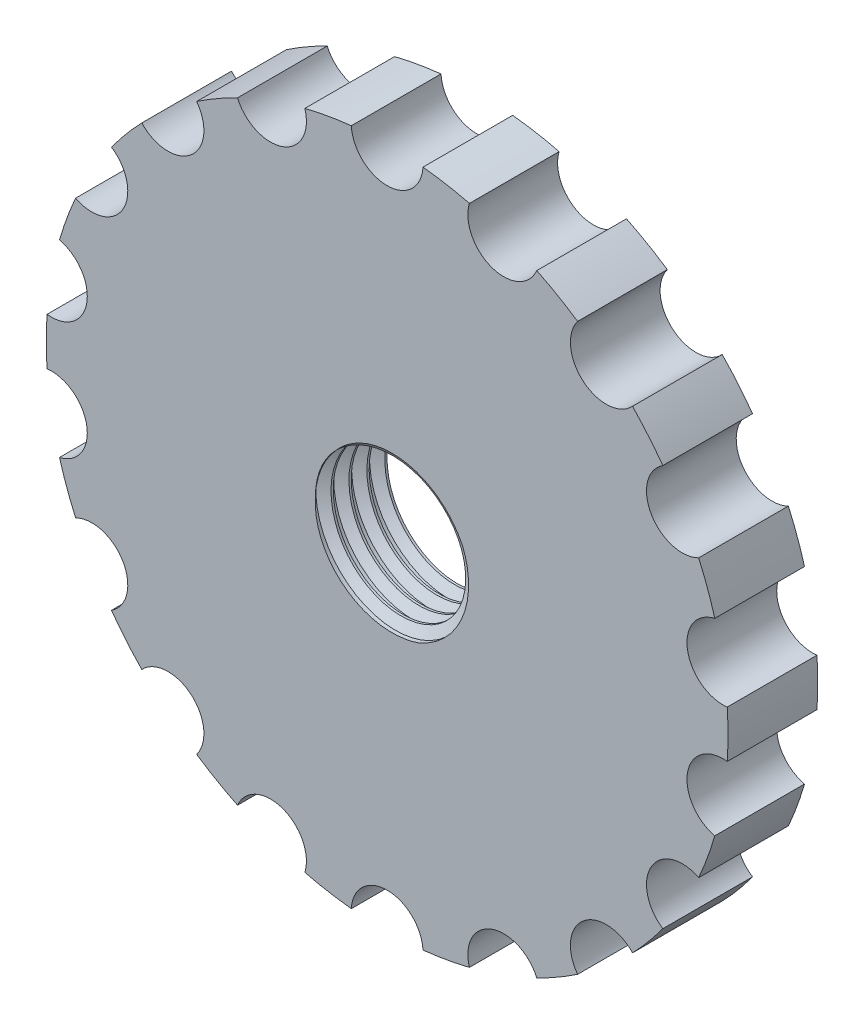
from build123d import *

# Parameters (mm, degrees)
SKETCH1_R               = 19
BOSS_EXTRUDE1_DEPTH     = 5
SKETCH5_R               = 2
CUT_EXTRUDE2_DEPTH      = 10
CUT_EXTRUDE3_DEPTH      = 28.258229589
CUT_EXTRUDE3_DEPTH_BACK = 28.258229589
SKETCH7_R               = 4
SKETCH8_R               = 7.6
CUT_EXTRUDE4_DEPTH      = 1
THREAD1_PITCH           = 1


with BuildPart() as part:
    # Sketch1 → Boss-Extrude1 (new body)
    with BuildSketch(Plane.XY):
        Circle(SKETCH1_R)
    extrude(amount=BOSS_EXTRUDE1_DEPTH)

    # Sketch5 → Cut-Extrude2 (cut)
    with BuildSketch(Plane.XY.offset(5)):
        with Locations((0, 19)):
            Circle(SKETCH5_R)
        with Locations((6.498382723, 17.854159795)):
            Circle(SKETCH5_R)
        with Locations((12.212964584, 14.554844419)):
            Circle(SKETCH5_R)
        with Locations((16.454482672, 9.5)):
            Circle(SKETCH5_R)
        with Locations((18.711347307, 3.299315376)):
            Circle(SKETCH5_R)
        with Locations((18.711347307, -3.299315376)):
            Circle(SKETCH5_R)
        with Locations((16.454482672, -9.5)):
            Circle(SKETCH5_R)
        with Locations((12.212964584, -14.554844419)):
            Circle(SKETCH5_R)
        with Locations((6.498382723, -17.854159795)):
            Circle(SKETCH5_R)
        with Locations((0, -19)):
            Circle(SKETCH5_R)
        with Locations((-6.498382723, -17.854159795)):
            Circle(SKETCH5_R)
        with Locations((-12.212964584, -14.554844419)):
            Circle(SKETCH5_R)
        with Locations((-16.454482672, -9.5)):
            Circle(SKETCH5_R)
        with Locations((-18.711347307, -3.299315376)):
            Circle(SKETCH5_R)
        with Locations((-18.711347307, 3.299315376)):
            Circle(SKETCH5_R)
        with Locations((-16.454482672, 9.5)):
            Circle(SKETCH5_R)
        with Locations((-12.212964584, 14.554844419)):
            Circle(SKETCH5_R)
        with Locations((-6.498382723, 17.854159795)):
            Circle(SKETCH5_R)
    extrude(amount=-CUT_EXTRUDE2_DEPTH, mode=Mode.SUBTRACT)

    # Sketch7 → Cut-Extrude3 (cut, two sides: drawn at the far end of the back side and taken through both)
    with BuildSketch(Plane(origin=(0, 0, 0), x_dir=(-1, 0, 0), z_dir=(0, 0, -1)).offset(-CUT_EXTRUDE3_DEPTH_BACK)):
        Circle(SKETCH7_R)
    extrude(amount=CUT_EXTRUDE3_DEPTH + CUT_EXTRUDE3_DEPTH_BACK, mode=Mode.SUBTRACT)

    # Sketch8 → Cut-Extrude4 (cut)
    with BuildSketch(Plane(origin=(0, 0, 0), x_dir=(-1, 0, 0), z_dir=(0, 0, -1))):
        Circle(SKETCH8_R)
    extrude(amount=-CUT_EXTRUDE4_DEPTH, mode=Mode.SUBTRACT)

    # Thread1: the profile of Thread Profile1 profile screwed along a right-hand helix of 10 turns, 8 arcs to a turn; built about Z, then put on its axis
    thread1_z = Axis((0, 0, 0), (0, 0, 1))
    thread1_corners = [(3.9997, 0, -0.000173205), (3.9997, 0, 0.875173202), (4.541265875, 0, 0.562499999), (4.541265875, 0, 0.312499999)]
    with BuildLine(mode=Mode.PRIVATE) as thread1_profile:
        Line(thread1_corners[0], thread1_corners[1])
        Line(thread1_corners[1], thread1_corners[2])
        Line(thread1_corners[2], thread1_corners[3])
        Line(thread1_corners[3], thread1_corners[0])
    thread1_cap = Face(thread1_profile.wire())
    thread1_turn_angles = [0, 22.5, 45, 67.5, 90, 112.5, 135, 157.5, 180, 202.5, 225, 247.5, 270, 292.5, 315, 337.5, 360]
    thread1_turn_weights = [1, 0.9238795325112867, 1, 0.9238795325112867, 1, 0.9238795325112867, 1, 0.9238795325112867, 1, 0.9238795325112867, 1, 0.9238795325112867, 1, 0.9238795325112867, 1, 0.9238795325112867, 1]
    thread1_turn_rails = [Edge.make_bspline([Vector(p[0], p[1], 0).rotate(thread1_z, thread1_turn_angles[k]) / thread1_turn_weights[k] + Vector(0, 0, p[2] + THREAD1_PITCH * thread1_turn_angles[k] / 360) for k in range(17)], [0, 0, 0, 1, 1, 2, 2, 3, 3, 4, 4, 5, 5, 6, 6, 7, 7, 8, 8, 8], 2, thread1_turn_weights) for p in thread1_corners]
    thread1_turn_sides = [Face.make_surface_from_curves(thread1_turn_rails[p[0]], thread1_turn_rails[p[1]]) for p in [(0, 1), (1, 2), (2, 3), (3, 0)]]
    thread1 = Plane(origin=(0, 0, 7), x_dir=(-1, 0, 0), z_dir=(0, 0, -1)) * Solid(Shell([*[p.moved(Location((0, 0, THREAD1_PITCH * i))) for i in range(10) for p in thread1_turn_sides], thread1_cap, thread1_cap.rotate(thread1_z, 3600).moved(Location((0, 0, THREAD1_PITCH * 3600 / 360)))]))
    add(thread1, mode=Mode.SUBTRACT)


solid = part.part
